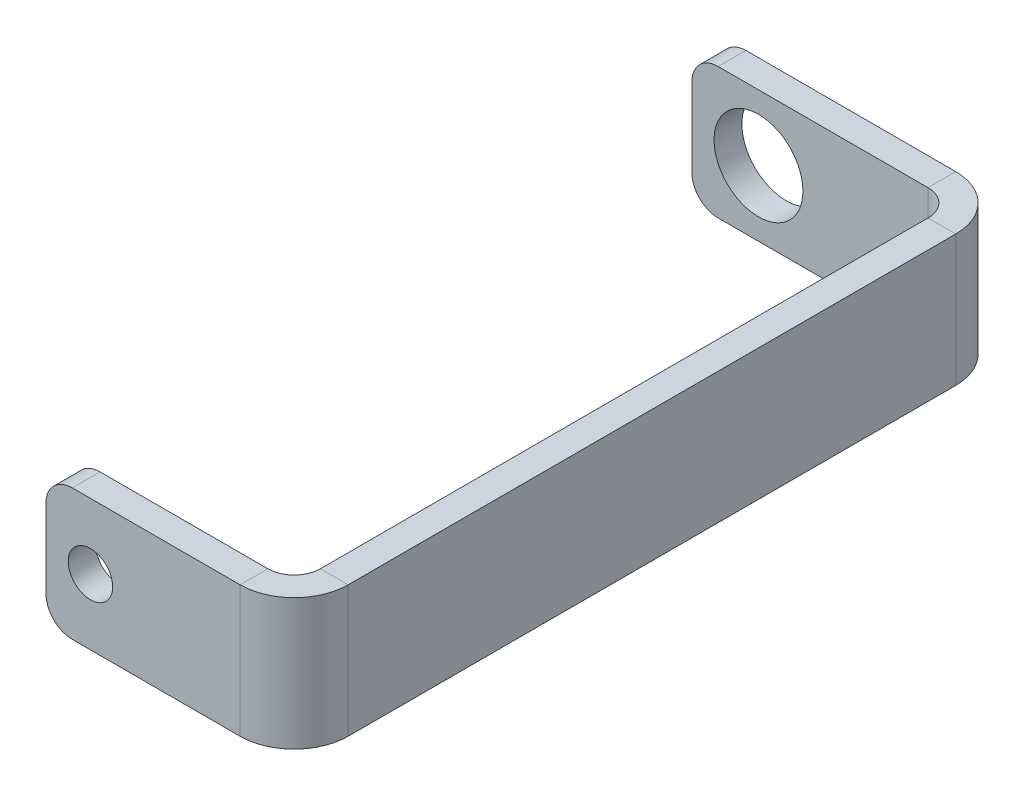
from build123d import *

# Parameters (mm, degrees)
SKETCH1_W                    = 30
SKETCH1_H                    = 15
BASE_FLANGE1_DEPTH           = 3.175
EDGE_FLANGE1_STRIP_W         = 18.7
EDGE_FLANGE1_STRIP_H         = 3.175
EDGE_FLANGE1_STRIP_CUT_DEPTH = 15
EDGE_FLANGE1_DEPTH           = 15
EDGE_FLANGE2_STRIP_W         = 18.7
EDGE_FLANGE2_STRIP_H         = 3.175
EDGE_FLANGE2_STRIP_CUT_DEPTH = 15
EDGE_FLANGE2_DEPTH           = 15
SKETCH14_R                   = 5.08
CUT_EXTRUDE1_DEPTH           = 82.072299394
SKETCH15_R                   = 2.54
CUT_EXTRUDE2_DEPTH           = 10
FILLET1_R                    = 3


# Sheet-metal steps are written as plain solids
with BuildPart() as part:
    # Sketch1 → Base-Flange1 (new body)
    with BuildSketch(Plane.XY):
        Rectangle(SKETCH1_W, SKETCH1_H)
    extrude(amount=-BASE_FLANGE1_DEPTH)

    # Edge-Flange1 strip (across the edge) → Edge-Flange1 strip cut (cut)
    with BuildSketch(Plane(origin=(15, -7.5, 0), x_dir=(-1, 0, 0), z_dir=(0, 1, 0))):
        with Locations((-6.35, -1.5875)):
            Rectangle(EDGE_FLANGE1_STRIP_W, EDGE_FLANGE1_STRIP_H)
    extrude(amount=EDGE_FLANGE1_STRIP_CUT_DEPTH, mode=Mode.SUBTRACT)

    # Edge-Flange1 section (across the edge) → Edge-Flange1 (add)
    with BuildSketch(Plane(origin=(15, -7.5, 0), x_dir=(-1, 0, 0), z_dir=(0, 1, 0))):
        with BuildLine():
            Line((-3.175, 3), (-3.175, 75.477))
            Line((-3.175, 75.477), (0, 75.477))
            Line((0, 75.477), (0, 3))
            ThreePointArc((0, 3), (0.878679656, 0.878679656), (3, 0))
            Line((3, 0), (3, -3.175))
            ThreePointArc((3, -3.175), (-1.366384374, -1.366384374), (-3.175, 3))
        make_face()
    extrude(amount=EDGE_FLANGE1_DEPTH)

    # Edge-Flange2 strip (across the edge) → Edge-Flange2 strip cut (cut)
    with BuildSketch(Plane(origin=(15, -7.5, 75.477), x_dir=(0, 0, -1), z_dir=(0, 1, 0))):
        with Locations((-6.35, -1.5875)):
            Rectangle(EDGE_FLANGE2_STRIP_W, EDGE_FLANGE2_STRIP_H)
    extrude(amount=EDGE_FLANGE2_STRIP_CUT_DEPTH, mode=Mode.SUBTRACT)

    # Edge-Flange2 section (across the edge) → Edge-Flange2 (add)
    with BuildSketch(Plane(origin=(15, -7.5, 75.477), x_dir=(0, 0, -1), z_dir=(0, 1, 0))):
        with BuildLine():
            Line((-3.175, 3), (-3.175, 25.195))
            Line((-3.175, 25.195), (0, 25.195))
            Line((0, 25.195), (0, 3))
            ThreePointArc((0, 3), (0.878679656, 0.878679656), (3, 0))
            Line((3, 0), (3, -3.175))
            ThreePointArc((3, -3.175), (-1.366384374, -1.366384374), (-3.175, 3))
        make_face()
    extrude(amount=EDGE_FLANGE2_DEPTH)

    # Sketch14 → Cut-Extrude1 (cut, through all)
    with BuildSketch(Plane.XY):
        with Locations((-7.38, 0)):
            Circle(SKETCH14_R)
    extrude(amount=-CUT_EXTRUDE1_DEPTH, mode=Mode.SUBTRACT)

    # Sketch15 → Cut-Extrude2 (cut)
    with BuildSketch(Plane.XY.offset(78.652)):
        with Locations((-5.115, 0)):
            Circle(SKETCH15_R)
    extrude(amount=-CUT_EXTRUDE2_DEPTH, mode=Mode.SUBTRACT)

    # Fillet1
    fillet1_edges = [part.edges().sort_by_distance(p)[0] for p in [
        (-10.195, -7.5, 77.0645),
        (-10.195, 7.5, 77.0645),
        (-15, -7.5, -1.5875),
        (-15, 7.5, -1.5875),
    ]]
    fillet(fillet1_edges, radius=FILLET1_R)


solid = part.part
